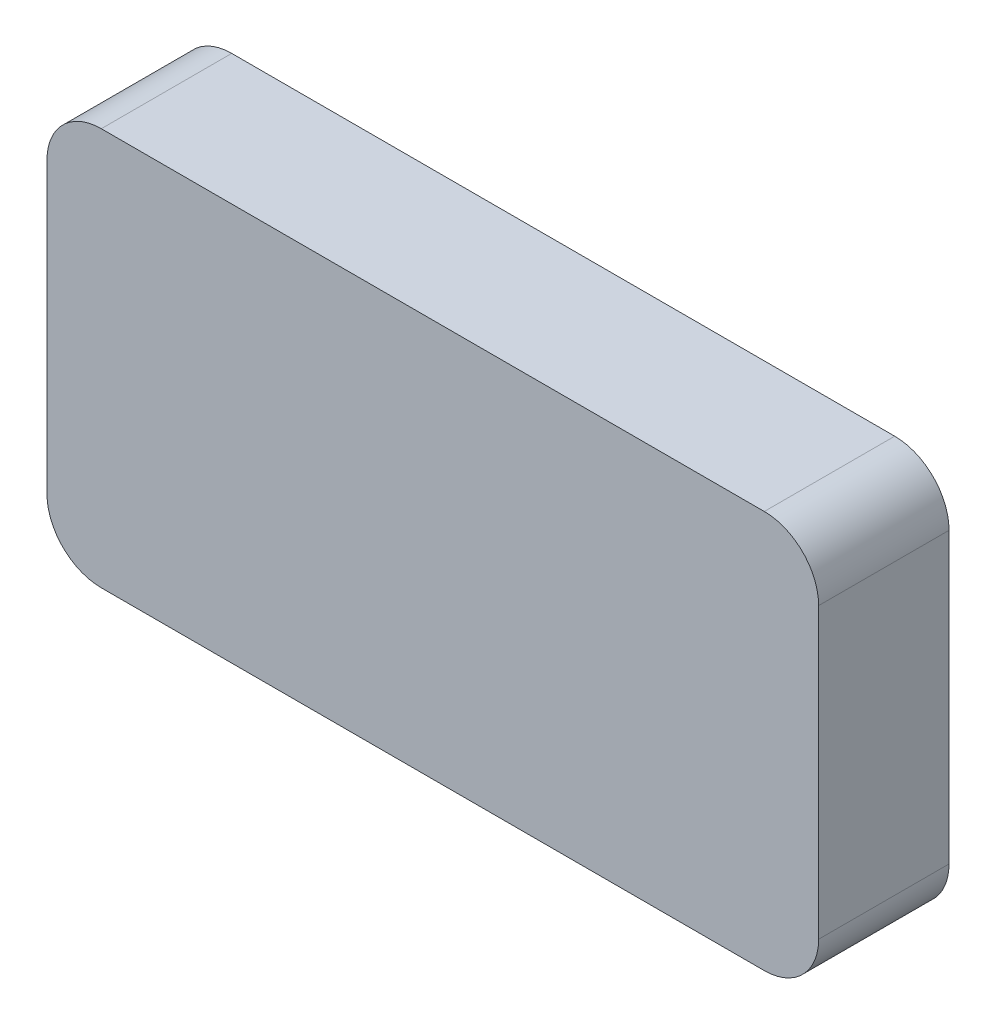
from build123d import *

# Parameters (mm, degrees)
SKETCH2_W           = 42.6
SKETCH2_H           = 21.95
BOSS_EXTRUDE1_DEPTH = 7.2
FILLET1_R           = 3


with BuildPart() as part:
    # Sketch2 → Boss-Extrude1 (new body)
    with BuildSketch(Plane.XY):
        Rectangle(SKETCH2_W, SKETCH2_H)
    extrude(amount=BOSS_EXTRUDE1_DEPTH)

    # Fillet1
    fillet1_edges = [part.edges().sort_by_distance(p)[0] for p in [
        (-21.3, -10.975, 3.6),
        (21.3, -10.975, 3.6),
        (21.3, 10.975, 3.6),
        (-21.3, 10.975, 3.6),
    ]]
    fillet(fillet1_edges, radius=FILLET1_R)


solid = part.part
